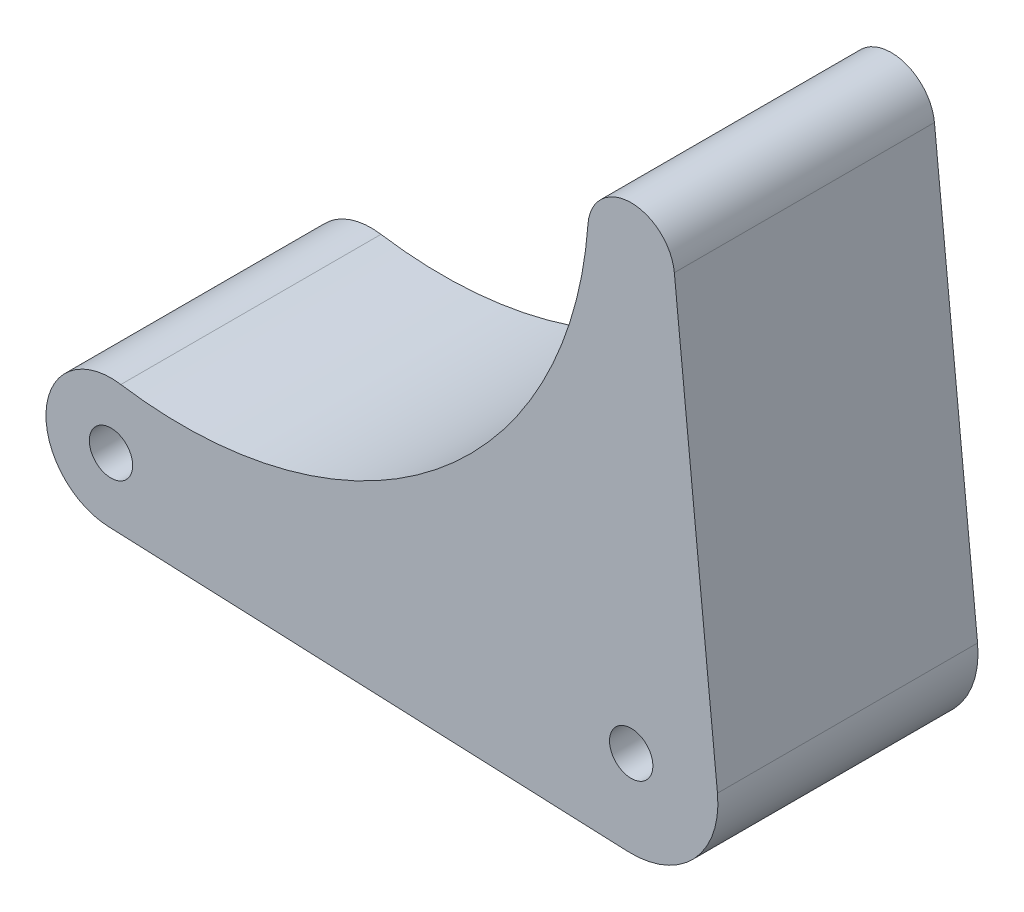
from build123d import *

# Parameters (mm, degrees)
SKETCH1_R           = 3.175
BOSS_EXTRUDE1_DEPTH = 38.1


with BuildPart() as part:
    # Sketch1 → Boss-Extrude1 (new body)
    with BuildSketch(Plane.XY):
        with BuildLine():
            Line((-76.596875, -9.516728179), (-0.529166667, -12.688970905))
            ThreePointArc((-0.529166667, -12.688970905), (9.239000565, -8.713832025), (12.636340451, 1.27))
            Line((12.636340451, 1.27), (6.318170226, 64.135))
            ThreePointArc((6.318170226, 64.135), (-0.08833437, 69.849385564), (-6.333390084, 63.95898807))
            ThreePointArc((-6.333390084, 63.95898807), (-28.602299903, 21.707467551), (-74.754015102, 9.414603161))
            ThreePointArc((-74.754015102, 9.414603161), (-85.680189052, 0.922843719), (-76.596875, -9.516728179))
        make_face()
        with Locations((-76.2, 0)):
            Circle(SKETCH1_R, mode=Mode.SUBTRACT)
        Circle(SKETCH1_R, mode=Mode.SUBTRACT)
    extrude(amount=BOSS_EXTRUDE1_DEPTH)


solid = part.part
